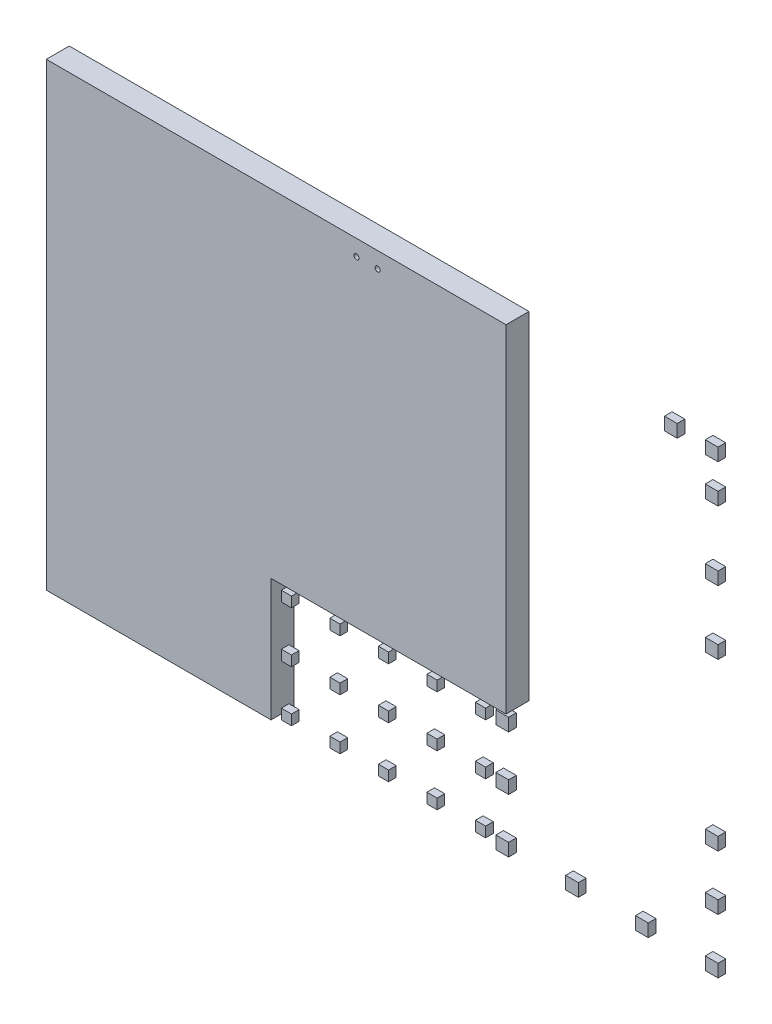
from build123d import *

# Parameters (mm, degrees)
SKETCH_1_R         = 50
EXTRUDE_1_DEPTH    = 150
SKETCH_1_W         = 250
SKETCH_1_H         = 250
EXTRUDE_1_2_DEPTH  = 150
EXTRUDE_1_3_DEPTH  = 150
EXTRUDE_1_4_DEPTH  = 150
EXTRUDE_1_5_DEPTH  = 150
EXTRUDE_1_6_DEPTH  = 150
EXTRUDE_1_7_DEPTH  = 150
EXTRUDE_1_8_DEPTH  = 150
EXTRUDE_1_9_DEPTH  = 150
EXTRUDE_1_10_DEPTH = 150
EXTRUDE_1_11_DEPTH = 150
EXTRUDE_1_12_DEPTH = 150
EXTRUDE_1_13_DEPTH = 150
EXTRUDE_1_14_DEPTH = 150
SKETCH_1_W_2       = 200
SKETCH_1_H_2       = 200
EXTRUDE_1_15_DEPTH = 150
EXTRUDE_1_16_DEPTH = 150
EXTRUDE_1_17_DEPTH = 150
EXTRUDE_1_18_DEPTH = 150
EXTRUDE_1_19_DEPTH = 150
EXTRUDE_1_20_DEPTH = 150
EXTRUDE_1_21_DEPTH = 150
EXTRUDE_1_22_DEPTH = 150
EXTRUDE_1_23_DEPTH = 150
EXTRUDE_1_24_DEPTH = 150
EXTRUDE_1_25_DEPTH = 150
EXTRUDE_1_26_DEPTH = 150
EXTRUDE_1_27_DEPTH = 150
EXTRUDE_1_28_DEPTH = 150
EXTRUDE_1_29_DEPTH = 150
EXTRUDE_2_DEPTH    = 300


with BuildPart() as part:
    # Эскиз1 → Бобышка-Вытянуть1 (new body)
    with BuildSketch(Plane.XY):
        Polygon((0, 0), (9000, 0), (9000, -6600), (4400, -6600), (4400, -9000), (0, -9000), align=None)
        with Locations((6486.244831881, -312.492160742)):
            Circle(SKETCH_1_R, mode=Mode.SUBTRACT)
        with Locations((6070.943926101, -312.492160742)):
            Circle(SKETCH_1_R, mode=Mode.SUBTRACT)
    extrude(amount=-EXTRUDE_1_DEPTH)

    # Эскиз2 → Бобышка-Вытянуть2 (add)
    with BuildSketch(Plane(origin=(0, 0, -150), x_dir=(-1, 0, 0), z_dir=(0, 0, -1))):
        Polygon((0, -9000), (0, 0), (-9000, 0), (-9000, -6600), (-4400, -6600), (-4400, -9000), align=None)
        Polygon((-450, -8550), (-450, -450), (-8550, -450), (-8550, -6150), (-3950, -6150), (-3950, -8550), align=None, mode=Mode.SUBTRACT)
    extrude(amount=EXTRUDE_2_DEPTH)


with BuildPart() as body_2:
    # Эскиз1 → Extrude 1 2 (new body)
    with BuildSketch(Plane.XY):
        with Locations((8925, -8875)):
            Rectangle(SKETCH_1_W, SKETCH_1_H)
    extrude(amount=-EXTRUDE_1_2_DEPTH)


with BuildPart() as body_3:
    # Эскиз1 → Extrude 1 3 (new body)
    with BuildSketch(Plane.XY):
        with Locations((8925, -6755)):
            Rectangle(SKETCH_1_W, SKETCH_1_H)
    extrude(amount=-EXTRUDE_1_3_DEPTH)


with BuildPart() as body_4:
    # Эскиз1 → Extrude 1 4 (new body)
    with BuildSketch(Plane.XY):
        with Locations((8925, -7815)):
            Rectangle(SKETCH_1_W, SKETCH_1_H)
    extrude(amount=-EXTRUDE_1_4_DEPTH)


with BuildPart() as body_5:
    # Эскиз1 → Extrude 1 5 (new body)
    with BuildSketch(Plane.XY):
        with Locations((10291.666666667, -8875)):
            Rectangle(SKETCH_1_W, SKETCH_1_H)
    extrude(amount=-EXTRUDE_1_5_DEPTH)


with BuildPart() as body_6:
    # Эскиз1 → Extrude 1 6 (new body)
    with BuildSketch(Plane.XY):
        with Locations((11658.333333333, -8875)):
            Rectangle(SKETCH_1_W, SKETCH_1_H)
    extrude(amount=-EXTRUDE_1_6_DEPTH)


with BuildPart() as body_7:
    # Эскиз1 → Extrude 1 7 (new body)
    with BuildSketch(Plane.XY):
        with Locations((13025, -8875)):
            Rectangle(SKETCH_1_W, SKETCH_1_H)
    extrude(amount=-EXTRUDE_1_7_DEPTH)


with BuildPart() as body_8:
    # Эскиз1 → Extrude 1 8 (new body)
    with BuildSketch(Plane.XY):
        with Locations((13025, -6725)):
            Rectangle(SKETCH_1_W, SKETCH_1_H)
    extrude(amount=-EXTRUDE_1_8_DEPTH)


with BuildPart() as body_9:
    # Эскиз1 → Extrude 1 9 (new body)
    with BuildSketch(Plane.XY):
        with Locations((13025, -7800)):
            Rectangle(SKETCH_1_W, SKETCH_1_H)
    extrude(amount=-EXTRUDE_1_9_DEPTH)


with BuildPart() as body_10:
    # Эскиз1 → Extrude 1 10 (new body)
    with BuildSketch(Plane.XY):
        with Locations((13025, -3475)):
            Rectangle(SKETCH_1_W, SKETCH_1_H)
    extrude(amount=-EXTRUDE_1_10_DEPTH)


with BuildPart() as body_11:
    # Эскиз1 → Extrude 1 11 (new body)
    with BuildSketch(Plane.XY):
        with Locations((13025, -2225)):
            Rectangle(SKETCH_1_W, SKETCH_1_H)
    extrude(amount=-EXTRUDE_1_11_DEPTH)


with BuildPart() as body_12:
    # Эскиз1 → Extrude 1 12 (new body)
    with BuildSketch(Plane.XY):
        with Locations((13025, -875)):
            Rectangle(SKETCH_1_W, SKETCH_1_H)
    extrude(amount=-EXTRUDE_1_12_DEPTH)


with BuildPart() as body_13:
    # Эскиз1 → Extrude 1 13 (new body)
    with BuildSketch(Plane.XY):
        with Locations((13025, -125)):
            Rectangle(SKETCH_1_W, SKETCH_1_H)
    extrude(amount=-EXTRUDE_1_13_DEPTH)


with BuildPart() as body_14:
    # Эскиз1 → Extrude 1 14 (new body)
    with BuildSketch(Plane.XY):
        with Locations((12225, -125)):
            Rectangle(SKETCH_1_W, SKETCH_1_H)
    extrude(amount=-EXTRUDE_1_14_DEPTH)


with BuildPart() as body_15:
    # Эскиз1 → Extrude 1 15 (new body)
    with BuildSketch(Plane.XY):
        with Locations((4700, -6800)):
            Rectangle(SKETCH_1_W_2, SKETCH_1_H_2)
    extrude(amount=-EXTRUDE_1_15_DEPTH)


with BuildPart() as body_16:
    # Эскиз1 → Extrude 1 16 (new body)
    with BuildSketch(Plane.XY):
        with Locations((4700, -7800)):
            Rectangle(SKETCH_1_W_2, SKETCH_1_H_2)
    extrude(amount=-EXTRUDE_1_16_DEPTH)


with BuildPart() as body_17:
    # Эскиз1 → Extrude 1 17 (new body)
    with BuildSketch(Plane.XY):
        with Locations((4700, -8800)):
            Rectangle(SKETCH_1_W_2, SKETCH_1_H_2)
    extrude(amount=-EXTRUDE_1_17_DEPTH)


with BuildPart() as body_18:
    # Эскиз1 → Extrude 1 18 (new body)
    with BuildSketch(Plane.XY):
        with Locations((5650, -6800)):
            Rectangle(SKETCH_1_W_2, SKETCH_1_H_2)
    extrude(amount=-EXTRUDE_1_18_DEPTH)


with BuildPart() as body_19:
    # Эскиз1 → Extrude 1 19 (new body)
    with BuildSketch(Plane.XY):
        with Locations((5650, -7800)):
            Rectangle(SKETCH_1_W_2, SKETCH_1_H_2)
    extrude(amount=-EXTRUDE_1_19_DEPTH)


with BuildPart() as body_20:
    # Эскиз1 → Extrude 1 20 (new body)
    with BuildSketch(Plane.XY):
        with Locations((5650, -8800)):
            Rectangle(SKETCH_1_W_2, SKETCH_1_H_2)
    extrude(amount=-EXTRUDE_1_20_DEPTH)


with BuildPart() as body_21:
    # Эскиз1 → Extrude 1 21 (new body)
    with BuildSketch(Plane.XY):
        with Locations((6600, -6800)):
            Rectangle(SKETCH_1_W_2, SKETCH_1_H_2)
    extrude(amount=-EXTRUDE_1_21_DEPTH)


with BuildPart() as body_22:
    # Эскиз1 → Extrude 1 22 (new body)
    with BuildSketch(Plane.XY):
        with Locations((6600, -7800)):
            Rectangle(SKETCH_1_W_2, SKETCH_1_H_2)
    extrude(amount=-EXTRUDE_1_22_DEPTH)


with BuildPart() as body_23:
    # Эскиз1 → Extrude 1 23 (new body)
    with BuildSketch(Plane.XY):
        with Locations((6600, -8800)):
            Rectangle(SKETCH_1_W_2, SKETCH_1_H_2)
    extrude(amount=-EXTRUDE_1_23_DEPTH)


with BuildPart() as body_24:
    # Эскиз1 → Extrude 1 24 (new body)
    with BuildSketch(Plane.XY):
        with Locations((7550, -6800)):
            Rectangle(SKETCH_1_W_2, SKETCH_1_H_2)
    extrude(amount=-EXTRUDE_1_24_DEPTH)


with BuildPart() as body_25:
    # Эскиз1 → Extrude 1 25 (new body)
    with BuildSketch(Plane.XY):
        with Locations((7550, -7800)):
            Rectangle(SKETCH_1_W_2, SKETCH_1_H_2)
    extrude(amount=-EXTRUDE_1_25_DEPTH)


with BuildPart() as body_26:
    # Эскиз1 → Extrude 1 26 (new body)
    with BuildSketch(Plane.XY):
        with Locations((7550, -8800)):
            Rectangle(SKETCH_1_W_2, SKETCH_1_H_2)
    extrude(amount=-EXTRUDE_1_26_DEPTH)


with BuildPart() as body_27:
    # Эскиз1 → Extrude 1 27 (new body)
    with BuildSketch(Plane.XY):
        with Locations((8500, -6800)):
            Rectangle(SKETCH_1_W_2, SKETCH_1_H_2)
    extrude(amount=-EXTRUDE_1_27_DEPTH)


with BuildPart() as body_28:
    # Эскиз1 → Extrude 1 28 (new body)
    with BuildSketch(Plane.XY):
        with Locations((8500, -7800)):
            Rectangle(SKETCH_1_W_2, SKETCH_1_H_2)
    extrude(amount=-EXTRUDE_1_28_DEPTH)


with BuildPart() as body_29:
    # Эскиз1 → Extrude 1 29 (new body)
    with BuildSketch(Plane.XY):
        with Locations((8500, -8800)):
            Rectangle(SKETCH_1_W_2, SKETCH_1_H_2)
    extrude(amount=-EXTRUDE_1_29_DEPTH)


solid = Compound([part.part, body_2.part, body_3.part, body_4.part, body_5.part, body_6.part, body_7.part, body_8.part, body_9.part, body_10.part, body_11.part, body_12.part, body_13.part, body_14.part, body_15.part, body_16.part, body_17.part, body_18.part, body_19.part, body_20.part, body_21.part, body_22.part, body_23.part, body_24.part, body_25.part, body_26.part, body_27.part, body_28.part, body_29.part])
